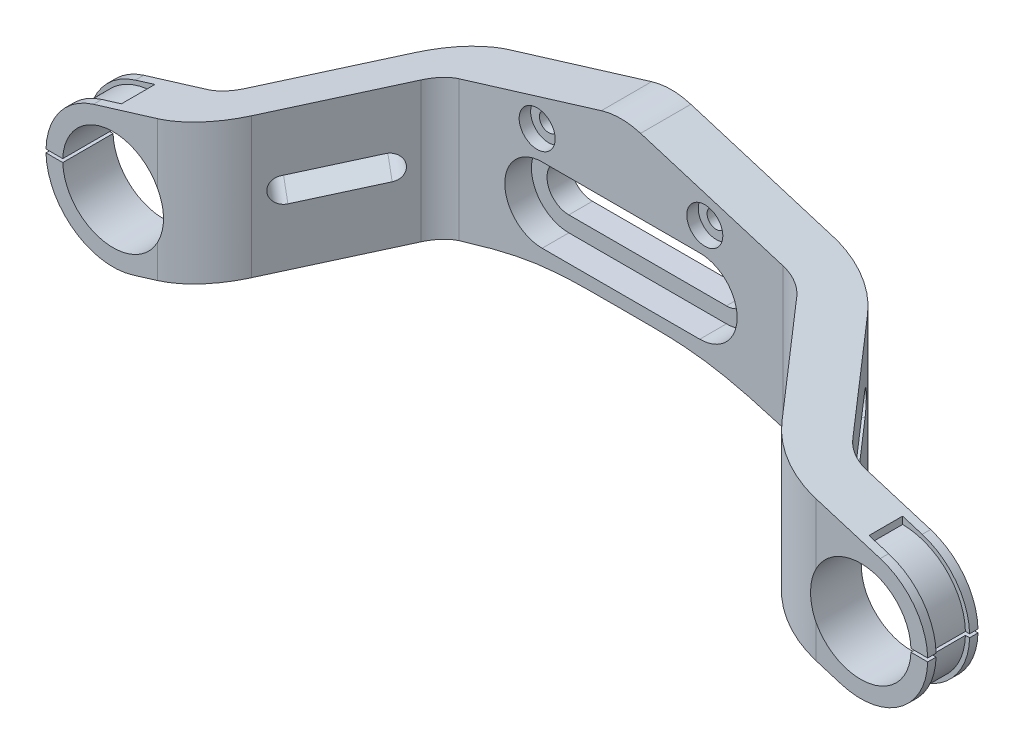
from build123d import *

# Parameters (mm, degrees)
EXTRUDE_THIN1_DEPTH                       = 150
SKETCH2_OUTSIDE_W                         = 349.23
SKETCH2_OUTSIDE_H                         = 219.23
CUT_EXTRUDE1_DEPTH                        = 337.154726279
SKETCH3_R                                 = 30
CUT_EXTRUDE2_DEPTH                        = 323.116973634
CUT_EXTRUDE3_START                        = -15
CUT_EXTRUDE3_DEPTH                        = 10
SKETCH5_W                                 = 100
SKETCH5_H                                 = 2
CUT_EXTRUDE4_DEPTH                        = 323.116973634
CBORE_START                               = 14.1
CBORE_SLOT_FOR_M24_HEX_HEAD_BOLT1_DEPTH   = 15.9
CBORE_SLOT_FOR_M24_HEX_HEAD_BOLT1_2_DEPTH = 14.1
CBORE_FOR_M10_HEX_HEAD_BOLT1_D            = 11
CBORE_FOR_M10_HEX_HEAD_BOLT1_CBORE_D      = 21.48
CBORE_FOR_M10_HEX_HEAD_BOLT1_CBORE_DEPTH  = 6.85
CUT_EXTRUDE5_DEPTH                        = 303.31664336
FILLET1_R                                 = 40


# Read off the part's stored shape, not the designer's step: CBORE SLOT for M24 Hex Head Bolt1
with BuildPart() as part:
    # Sketch1 → Extrude-Thin1 (new body)
    with BuildSketch(Plane(origin=(0, 0, 0), x_dir=(1, 0, 0), z_dir=(0, 1, 0))):
        with BuildLine():
            Line((0, 0), (-96.684617092, 0))
            ThreePointArc((-96.684617092, 0), (-117.815530179, -4.684610648), (-134.986839248, -17.860619516))
            Line((-134.986839248, -17.860619516), (-181.133234795, -72.855752194))
            ThreePointArc((-181.133234795, -72.855752194), (-188.001758422, -78.126155741), (-196.454123657, -80))
            Line((-196.454123657, -80), (-280, -80))
            Line((-280, -80), (-280, -110))
            Line((-280, -110), (-196.454123657, -110))
            ThreePointArc((-196.454123657, -110), (-175.32321057, -105.315389352), (-158.151901501, -92.139380484))
            Line((-158.151901501, -92.139380484), (-112.005505955, -37.144247806))
            ThreePointArc((-112.005505955, -37.144247806), (-105.136982327, -31.873844259), (-96.684617092, -30))
            Line((-96.684617092, -30), (0, -30))
            Line((0, -30), (0, 0))
        make_face()
    extrude(amount=-EXTRUDE_THIN1_DEPTH)

    # Sketch2 outside → Cut-Extrude1 (cut, through all)
    with BuildSketch(Plane.XY):
        with Locations((-140, -75)):
            Rectangle(SKETCH2_OUTSIDE_W, SKETCH2_OUTSIDE_H)
        with BuildLine():
            Line((0, 0), (-234.676511429, -71.747809761))
            ThreePointArc((-234.676511429, -71.747809761), (-261.233833478, -121.694868189), (-211.286775051, -148.252190239))
            Line((-211.286775051, -148.252190239), (-95, -112.699755258))
            add(Edge.make_bspline(
                [(-95, -112.699755258), (-51.532544729, -99.410420536), (-36.95554526, -100), (0, -100)],
                knots=[0, 0, 0, 0, 1, 1, 1, 1], degree=3))
            Line((0, -100), (0, 0))
        make_face(mode=Mode.SUBTRACT)
    extrude(amount=CUT_EXTRUDE1_DEPTH, mode=Mode.SUBTRACT)

    # Sketch3 → Cut-Extrude2 (cut, through all)
    with BuildSketch(Plane.XY.offset(110)):
        with Locations(Location((-222.98164324, -110, 0), (0, 0, 27.840553026))):
            Circle(SKETCH3_R)
    extrude(amount=-CUT_EXTRUDE2_DEPTH, mode=Mode.SUBTRACT)

    # Sketch4 → Cut-Extrude3 (cut, symmetric)
    with BuildSketch(Plane.XY.offset(110).offset(CUT_EXTRUDE3_START)):
        with BuildLine():
            Line((-222.98164324, -68.172329741), (-222.98164324, -72.5))
            ThreePointArc((-222.98164324, -72.5), (-260.48164324, -110), (-222.98164324, -147.5))
            Line((-222.98164324, -147.5), (-222.98164324, -150))
            ThreePointArc((-222.98164324, -150), (-262.542277774, -115.912376445), (-234.676511429, -71.747809761))
            Line((-234.676511429, -71.747809761), (-222.98164324, -68.172329741))
        make_face()
    extrude(amount=CUT_EXTRUDE3_DEPTH, both=True, mode=Mode.SUBTRACT)

    # Sketch5 → Cut-Extrude4 (cut, through all)
    with BuildSketch(Plane.XY.offset(110)):
        with Locations((-272.98164324, -110)):
            Rectangle(SKETCH5_W, SKETCH5_H)
    extrude(amount=-CUT_EXTRUDE4_DEPTH, mode=Mode.SUBTRACT)

    # CBORE SLOT for M24 Hex Head Bolt1 outlin → CBORE SLOT for M24 Hex Head Bolt1 (cut)
    with BuildSketch(Plane.XY.offset(CBORE_START)):
        with BuildLine():
            Line((0, -47.715), (-47, -47.715))
            ThreePointArc((-47, -47.715), (-69.285, -70), (-47, -92.285))
            Line((-47, -92.285), (0, -92.285))
            Line((0, -92.285), (0, -47.715))
        make_face()
    extrude(amount=CBORE_SLOT_FOR_M24_HEX_HEAD_BOLT1_DEPTH, mode=Mode.SUBTRACT)

    # CBORE SLOT for M24 Hex Head Bolt1 2 outl → CBORE SLOT for M24 Hex Head Bolt1 2 (cut)
    with BuildSketch(Plane.XY):
        with BuildLine():
            Line((0, -83), (0, -57))
            Line((0, -57), (-47, -57))
            ThreePointArc((-47, -57), (-60, -70), (-47, -83))
            Line((-47, -83), (0, -83))
        make_face()
    extrude(amount=CBORE_SLOT_FOR_M24_HEX_HEAD_BOLT1_2_DEPTH, mode=Mode.SUBTRACT)

    # CBORE for M10 Hex Head Bolt1 (through all)
    with Locations(Plane.XY.offset(30)):
        with Locations((-50, -32)):
            CounterBoreHole(CBORE_FOR_M10_HEX_HEAD_BOLT1_D / 2, CBORE_FOR_M10_HEX_HEAD_BOLT1_CBORE_D / 2, CBORE_FOR_M10_HEX_HEAD_BOLT1_CBORE_DEPTH)

    # Sketch11 → Cut-Extrude5 (cut, through all)
    with BuildSketch(Plane(origin=(-47.437557366, 0, -39.80483689), x_dir=(0.6427876096865384, 0, -0.7660444431189788), z_dir=(0.7660444431189788, 0, 0.6427876096865384))):
        with BuildLine():
            Line((-159.78881321, -80.089014291), (-115.633379107, -71.411593064))
            ThreePointArc((-115.633379107, -71.411593064), (-106.827903218, -77.32459521), (-112.740905364, -86.130071099))
            Line((-112.740905364, -86.130071099), (-156.896339468, -94.807492326))
            ThreePointArc((-156.896339468, -94.807492326), (-165.701815356, -88.89449018), (-159.78881321, -80.089014291))
        make_face()
    extrude(amount=-CUT_EXTRUDE5_DEPTH, mode=Mode.SUBTRACT)

    # Mirror1: part across plane


with BuildPart() as part_1:
    add(part.part)
    add(part.part.mirror(Plane(origin=(0, -150, 0), x_dir=(0, 0, 1), z_dir=(-1, 0, 0))))

    # Fillet1
    fillet1_edges = [part_1.edges().sort_by_distance(p)[0] for p in [
        (0, 0, 15),
    ]]
    fillet(fillet1_edges, radius=FILLET1_R)


solid = part_1.part
